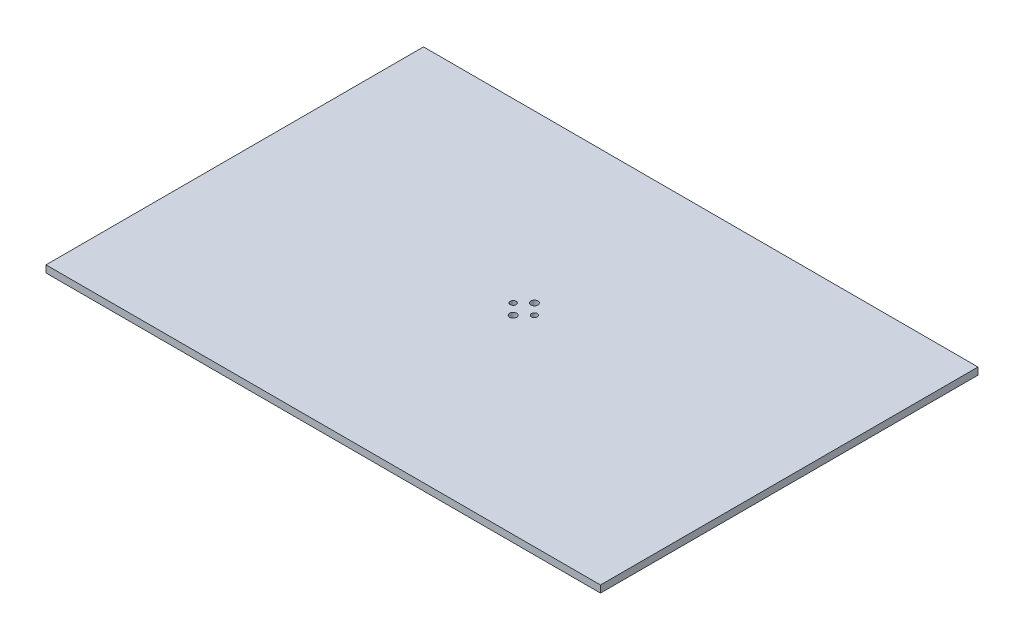
from build123d import *

# Parameters (mm, degrees)
SKETCH1_W           = 470
SKETCH1_H           = 320
BOSS_EXTRUDE1_DEPTH = 6
SKETCH2_R           = 3
SKETCH2_R_2         = 2.5
CUT_EXTRUDE1_DEPTH  = 6


with BuildPart() as part:
    # Sketch1 → Boss-Extrude1 (new body)
    with BuildSketch(Plane(origin=(0, 0, 0), x_dir=(1, 0, 0), z_dir=(0, 1, 0))):
        with Locations((235, 160)):
            Rectangle(SKETCH1_W, SKETCH1_H)
    extrude(amount=BOSS_EXTRUDE1_DEPTH)

    # Sketch2 → Cut-Extrude1 (cut)
    with BuildSketch(Plane(origin=(0, 6, 0), x_dir=(1, 0, 0), z_dir=(0, 1, 0))):
        with Locations((235, 161)):
            Circle(SKETCH2_R)
        with Locations((235, 179)):
            Circle(SKETCH2_R)
        with Locations((226, 170)):
            Circle(SKETCH2_R_2)
        with Locations((244, 170)):
            Circle(SKETCH2_R_2)
    extrude(amount=-CUT_EXTRUDE1_DEPTH, mode=Mode.SUBTRACT)


solid = part.part
